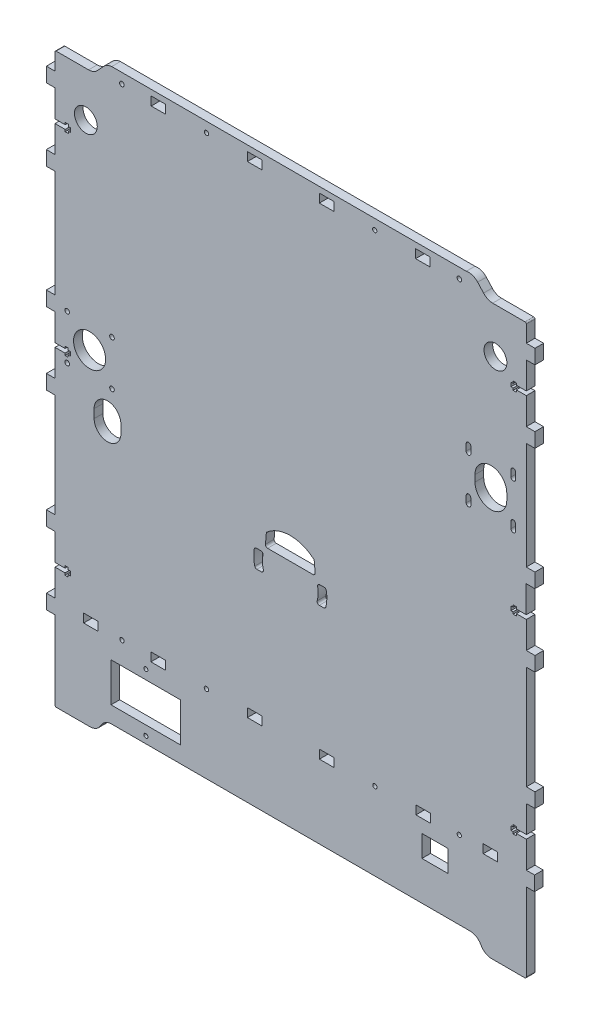
from build123d import *

# Parameters (mm, degrees)
SKETCH_1_R      = 7.9
SKETCH_1_R_2    = 1.6
SKETCH_1_R_3    = 1.5
SKETCH_1_R_4    = 11.1
SKETCH_1_R_5    = 1.4
SKETCH_1_W      = 10
SKETCH_1_H      = 6
SKETCH_1_W_2    = 18
SKETCH_1_H_2    = 15
SKETCH_1_W_3    = 48
SKETCH_1_H_3    = 27
EXTRUDE_1_DEPTH = 6


with BuildPart() as part:
    # Эскиз1 → Бобышка-Вытянуть1 (new body)
    with BuildSketch(Plane.XY):
        with BuildLine():
            Line((-197.487602206, 21.424334113), (-197.486561677, 20.054248176))
            Line((-197.486561677, 20.054248176), (-195.286801854, 20.054248176))
            Line((-195.286801854, 20.054248176), (-195.286817832, 21.426921304))
            Line((-195.286817832, 21.426921304), (-195.286801854, 21.454129382))
            Line((-195.286801854, 21.454129382), (-193.786801854, 21.454129382))
            Line((-193.786801854, 21.454129382), (-193.786801854, 24.24851002))
            Line((-193.786801854, 24.24851002), (-193.786785876, 24.275718097))
            Line((-193.786785876, 24.275718097), (-195.286785876, 24.275718097))
            Line((-195.286785876, 24.275718097), (-195.287641863, 25.64942725))
            Line((-195.287641863, 25.64942725), (-195.287642523, 25.676635332))
            Line((-195.287642523, 25.676635332), (-197.487642934, 25.676635332))
            Line((-197.487642934, 25.676635332), (-197.487638249, 25.64942725))
            Line((-197.487638249, 25.64942725), (-197.487435772, 24.276635347))
            Line((-197.487435772, 24.276635347), (-204.436337757, 24.276635347))
            Line((-204.436337757, 24.276635347), (-204.436337757, 42.876635347))
            Line((-204.436337757, 42.876635347), (-210.436337757, 42.876635347))
            Line((-210.436337757, 42.876635347), (-210.436337757, 52.876635347))
            Line((-210.436337757, 52.876635347), (-204.436337757, 52.876635347))
            Line((-204.436337757, 52.876635347), (-204.436337757, 127.036635347))
            Line((-204.436337757, 127.036635347), (-210.436337757, 127.036635347))
            Line((-210.436337757, 127.036635347), (-210.436337757, 137.036635347))
            Line((-210.436337757, 137.036635347), (-204.436337757, 137.036635347))
            Line((-204.436337757, 137.036635347), (-204.436337757, 155.636635347))
            Line((-204.436337757, 155.636635347), (-197.387139854, 155.636635347))
            Line((-197.387139854, 155.636635347), (-197.387139854, 154.236531323))
            Line((-197.387139854, 154.236531323), (-195.186317271, 154.236531323))
            Line((-195.186317271, 154.236531323), (-195.186317271, 155.618966061))
            Line((-195.186317271, 155.618966061), (-193.715479854, 155.618966061))
            Line((-193.715479854, 155.618966061), (-193.715479854, 158.418966061))
            Line((-193.715479854, 158.418966061), (-195.218141804, 158.418966061))
            Line((-195.218141804, 158.418966061), (-195.218141804, 159.836635347))
            Line((-195.218141804, 159.836635347), (-197.418142215, 159.836635347))
            Line((-197.418142215, 159.836635347), (-197.418142215, 158.436635347))
            Line((-197.418142215, 158.436635347), (-204.436337757, 158.436635347))
            Line((-204.436337757, 158.436635347), (-204.436337757, 177.036635347))
            Line((-204.436337757, 177.036635347), (-210.436337757, 177.036635347))
            Line((-210.436337757, 177.036635347), (-210.436337757, 187.036635347))
            Line((-210.436337757, 187.036635347), (-204.436337757, 187.036635347))
            Line((-204.436337757, 187.036635347), (-204.436337757, 198.258791497))
            ThreePointArc((-204.436337757, 198.258791497), (-204.328344016, 199.026576962), (-203.670309603, 199.436635347))
            Line((-203.670309603, 199.436635347), (-181.21366511, 199.436635347))
            ThreePointArc((-181.21366511, 199.436635347), (-177.786697283, 200.165852645), (-174.944614984, 202.214860835))
            Line((-174.944614984, 202.214860835), (-170.849061928, 206.694475052))
            ThreePointArc((-170.849061928, 206.694475052), (-168.285810468, 208.606816645), (-165.197330366, 209.436635347))
            Line((-165.197330366, 209.436635347), (80.233513167, 209.436635347))
            ThreePointArc((80.233513167, 209.436635347), (84.503563818, 209.155552648), (88.09552196, 206.829573983))
            Line((88.09552196, 206.829573983), (92.195746981, 202.354235654))
            ThreePointArc((92.195746981, 202.354235654), (95.023116575, 200.232431533), (98.467355239, 199.436635347))
            Line((98.467355239, 199.436635347), (120.843662243, 199.436635347))
            ThreePointArc((120.843662243, 199.436635347), (121.494200482, 199.167173586), (121.763662243, 198.516635347))
            Line((121.763662243, 198.516635347), (121.763662243, 187.036635347))
            Line((121.763662243, 187.036635347), (127.763662243, 187.036635347))
            Line((127.763662243, 187.036635347), (127.763662243, 177.036635347))
            Line((127.763662243, 177.036635347), (121.763662243, 177.036635347))
            Line((121.763662243, 177.036635347), (121.763662243, 158.436635347))
            Line((121.763662243, 158.436635347), (114.851661036, 158.436635347))
            Line((114.851661036, 158.436635347), (114.851661036, 159.836739372))
            Line((114.851661036, 159.836739372), (112.650838454, 159.836739372))
            Line((112.650838454, 159.836739372), (112.651660526, 158.436858407))
            Line((112.651660526, 158.436858407), (111.151660785, 158.435977541))
            Line((111.151660785, 158.435977541), (111.15330453, 155.636894735))
            Line((111.15330453, 155.636894735), (112.653304271, 155.637775601))
            Line((112.653304271, 155.637775601), (112.654126952, 154.236858346))
            Line((112.654126952, 154.236858346), (114.854127367, 154.236805006))
            Line((114.854127367, 154.236805006), (114.854161306, 155.636635347))
            Line((114.854161306, 155.636635347), (121.763662346, 155.636635347))
            Line((121.763662346, 155.636635347), (121.763662346, 137.036635347))
            Line((121.763662346, 137.036635347), (127.735522472, 137.036635347))
            Line((127.735522472, 137.036635347), (127.735522472, 127.036635347))
            Line((127.735522472, 127.036635347), (121.735522472, 127.036635347))
            Line((121.735522472, 127.036635347), (121.735522472, 52.876635347))
            Line((121.735522472, 52.876635347), (127.735522472, 52.876635347))
            Line((127.735522472, 52.876635347), (127.735522472, 42.876635347))
            Line((127.735522472, 42.876635347), (121.73141262, 42.876635347))
            Line((121.73141262, 42.876635347), (121.73141262, 24.276635347))
            Line((121.73141262, 24.276635347), (114.867621421, 24.276635347))
            Line((114.867621421, 24.276635347), (114.867616759, 24.303704553))
            Line((114.867616759, 24.303704553), (114.867380328, 25.676569221))
            Line((114.867380328, 25.676569221), (112.666557749, 25.676190201))
            Line((112.666557749, 25.676190201), (112.667616243, 24.303378605))
            Line((112.667616243, 24.303378605), (112.667620905, 24.276309399))
            Line((112.667620905, 24.276309399), (111.167621337, 24.275170207))
            Line((111.167621337, 24.275170207), (111.169742471, 21.503156931))
            Line((111.169742471, 21.503156931), (111.169747133, 21.476087726))
            Line((111.169747133, 21.476087726), (112.6697467, 21.477226918))
            Line((112.6697467, 21.477226918), (112.670805981, 20.103379031))
            Line((112.670805981, 20.103379031), (112.670810643, 20.076309825))
            Line((112.670810643, 20.076309825), (114.87081103, 20.076635363))
            Line((114.87081103, 20.076635363), (114.870806368, 20.103704568))
            Line((114.870806368, 20.103704568), (114.87060387, 21.476635347))
            Line((114.87060387, 21.476635347), (121.780104909, 21.476635347))
            Line((121.780104909, 21.476635347), (121.780104909, 2.876635347))
            Line((121.780104909, 2.876635347), (127.777161917, 2.876635347))
            Line((127.777161917, 2.876635347), (127.777161917, -7.123364653))
            Line((127.777161917, -7.123364653), (121.777161917, -7.123364653))
            Line((121.777161917, -7.123364653), (121.777161917, -78.853364653))
            Line((121.777161917, -78.853364653), (127.777161917, -78.853364653))
            Line((127.777161917, -78.853364653), (127.777161917, -88.853364653))
            Line((127.777161917, -88.853364653), (121.865168685, -88.853364653))
            Line((121.865168685, -88.853364653), (121.865168685, -107.433364653))
            Line((121.865168685, -107.433364653), (114.865167478, -107.433364653))
            Line((114.865167478, -107.433364653), (114.865167478, -106.033260628))
            Line((114.865167478, -106.033260628), (112.664344896, -106.033260628))
            Line((112.664344896, -106.033260628), (112.665166968, -107.433141593))
            Line((112.665166968, -107.433141593), (111.165167227, -107.434022459))
            Line((111.165167227, -107.434022459), (111.166810972, -110.233105265))
            Line((111.166810972, -110.233105265), (112.666810713, -110.232224399))
            Line((112.666810713, -110.232224399), (112.667633394, -111.633141654))
            Line((112.667633394, -111.633141654), (114.870838426, -111.633195072))
            Line((114.870838426, -111.633195072), (114.870872365, -110.233364653))
            Line((114.870872365, -110.233364653), (121.763662243, -110.233364653))
            Line((121.763662243, -110.233364653), (121.763662243, -128.843364653))
            Line((121.763662243, -128.843364653), (127.47801658, -128.843364653))
            Line((127.47801658, -128.843364653), (127.47801658, -138.843364653))
            Line((127.47801658, -138.843364653), (121.763662243, -138.843364653))
            Line((121.763662243, -138.843364653), (121.763662243, -192.691567269))
            ThreePointArc((121.763662243, -192.691567269), (121.517292149, -193.467005783), (120.806727052, -193.863364653))
            Line((120.806727052, -193.863364653), (97.806335191, -193.863364653))
            ThreePointArc((97.806335191, -193.863364653), (94.253903134, -193.044338241), (91.377078173, -190.805040153))
            Line((91.377078173, -190.805040153), (89.320374027, -187.785387058))
            ThreePointArc((89.320374027, -187.785387058), (86.401251485, -185.545465551), (82.80899626, -184.74908174))
            Line((82.80899626, -184.74908174), (-165.15931457, -184.74908174))
            ThreePointArc((-165.15931457, -184.74908174), (-168.751153818, -185.547339588), (-171.669107354, -187.788783751))
            Line((-171.669107354, -187.788783751), (-173.724235811, -190.809509456))
            ThreePointArc((-173.724235811, -190.809509456), (-176.639720291, -193.057976183), (-180.232351887, -193.863364653))
            Line((-180.232351887, -193.863364653), (-203.35849545, -193.863364653))
            ThreePointArc((-203.35849545, -193.863364653), (-204.158043867, -193.595905372), (-204.436337757, -192.800063271))
            Line((-204.436337757, -192.800063271), (-204.436337757, -138.843364653))
            Line((-204.436337757, -138.843364653), (-210.431075973, -138.843364653))
            Line((-210.431075973, -138.843364653), (-210.431075973, -128.843364653))
            Line((-210.431075973, -128.843364653), (-204.436337757, -128.843364653))
            Line((-204.436337757, -128.843364653), (-204.436337757, -110.233364653))
            Line((-204.436337757, -110.233364653), (-197.523921698, -110.233364653))
            Line((-197.523921698, -110.233364653), (-197.523672393, -111.68096837))
            Line((-197.523672393, -111.68096837), (-195.335013115, -111.679449577))
            Line((-195.335013115, -111.679449577), (-195.336806264, -110.279844178))
            Line((-195.336806264, -110.279844178), (-193.677914745, -110.277769726))
            Line((-193.677914745, -110.277769726), (-193.68325579, -107.284374899))
            Line((-193.68325579, -107.284374899), (-195.328101329, -107.286501137))
            Line((-195.328101329, -107.286501137), (-195.329942101, -105.895501094))
            Line((-195.329942101, -105.895501094), (-197.490847394, -105.897039343))
            Line((-197.490847394, -105.897039343), (-197.490620059, -107.433364653))
            Line((-197.490620059, -107.433364653), (-204.436337757, -107.433364653))
            Line((-204.436337757, -107.433364653), (-204.436337757, -88.853364653))
            Line((-204.436337757, -88.853364653), (-210.436337757, -88.853364653))
            Line((-210.436337757, -88.853364653), (-210.436337757, -78.853364653))
            Line((-210.436337757, -78.853364653), (-204.436337757, -78.853364653))
            Line((-204.436337757, -78.853364653), (-204.436337757, -7.123364653))
            Line((-204.436337757, -7.123364653), (-210.436337757, -7.123364653))
            Line((-210.436337757, -7.123364653), (-210.436337757, 2.876635347))
            Line((-210.436337757, 2.876635347), (-204.436337757, 2.876635347))
            Line((-204.436337757, 2.876635347), (-204.436337757, 21.456635347))
            Line((-204.436337757, 21.456635347), (-204.436337757, 21.476635347))
            Line((-204.436337757, 21.476635347), (-197.487641927, 21.476635347))
            Line((-197.487641927, 21.476635347), (-197.487602206, 21.424334113))
        make_face()
        with Locations((-183.086337757, 168.436635347)):
            Circle(SKETCH_1_R, mode=Mode.SUBTRACT)
        with Locations((100.408400459, 168.436635347)):
            Circle(SKETCH_1_R, mode=Mode.SUBTRACT)
        with Locations((-158.141599541, 202.436635347)):
            Circle(SKETCH_1_R_2, mode=Mode.SUBTRACT)
        with Locations((75.458400459, 202.436635347)):
            Circle(SKETCH_1_R_2, mode=Mode.SUBTRACT)
        with Locations((16.858400459, 202.436635347)):
            Circle(SKETCH_1_R_3, mode=Mode.SUBTRACT)
        with Locations((-99.541599541, 202.436635347)):
            Circle(SKETCH_1_R_3, mode=Mode.SUBTRACT)
        with Locations((-196.006387984, 47.305988871)):
            Circle(SKETCH_1_R_2, mode=Mode.SUBTRACT)
        with Locations((-165.006387984, 16.305988871)):
            Circle(SKETCH_1_R_2, mode=Mode.SUBTRACT)
        with Locations((-196.006387984, 16.305988871)):
            Circle(SKETCH_1_R_2, mode=Mode.SUBTRACT)
        with Locations((-180.506387984, 31.805988871)):
            Circle(SKETCH_1_R_4, mode=Mode.SUBTRACT)
        with Locations((-165.006387984, 47.305988871)):
            Circle(SKETCH_1_R_2, mode=Mode.SUBTRACT)
        with Locations((75.383662243, -130.863364653)):
            Circle(SKETCH_1_R_3, mode=Mode.SUBTRACT)
        with Locations((16.983662243, -130.863364653)):
            Circle(SKETCH_1_R_3, mode=Mode.SUBTRACT)
        with Locations((-99.656337757, -130.863364653)):
            Circle(SKETCH_1_R_3, mode=Mode.SUBTRACT)
        with Locations((-158.056337757, -130.863364653)):
            Circle(SKETCH_1_R_3, mode=Mode.SUBTRACT)
        with Locations((-141.555168688, -179.94908174)):
            Circle(SKETCH_1_R_5, mode=Mode.SUBTRACT)
        with Locations((-141.555168688, -139.94908174)):
            Circle(SKETCH_1_R_5, mode=Mode.SUBTRACT)
        with Locations((-16.416337757, -130.863364653)):
            Rectangle(SKETCH_1_W, SKETCH_1_H, mode=Mode.SUBTRACT)
        with Locations((-66.256337757, -130.863364653)):
            Rectangle(SKETCH_1_W, SKETCH_1_H, mode=Mode.SUBTRACT)
        with Locations((58.493612016, -150.412798349)):
            Rectangle(SKETCH_1_W_2, SKETCH_1_H_2, mode=Mode.SUBTRACT)
        with Locations((-133.056337757, -130.863364653)):
            Rectangle(SKETCH_1_W, SKETCH_1_H, mode=Mode.SUBTRACT)
        with Locations((-179.636337757, -130.863364653)):
            Rectangle(SKETCH_1_W, SKETCH_1_H, mode=Mode.SUBTRACT)
        with Locations((96.963662243, -130.863364653)):
            Rectangle(SKETCH_1_W, SKETCH_1_H, mode=Mode.SUBTRACT)
        with Locations((50.383662243, -130.863364653)):
            Rectangle(SKETCH_1_W, SKETCH_1_H, mode=Mode.SUBTRACT)
        with BuildLine():
            Line((-18.134599873, -29.194011129), (-21.184312759, -29.194011129))
            ThreePointArc((-21.184312759, -29.194011129), (-22.342493839, -29.740797309), (-22.65630504, -30.982522347))
            ThreePointArc((-22.65630504, -30.982522347), (-22.309250666, -35.408837109), (-22.983068573, -39.797308203))
            ThreePointArc((-22.983068573, -39.797308203), (-22.72917458, -41.103666451), (-21.536477135, -41.694011129))
            Line((-21.536477135, -41.694011129), (-18.440328783, -41.694011129))
            ThreePointArc((-18.440328783, -41.694011129), (-17.510284763, -41.370879057), (-16.980943477, -40.540701957))
            ThreePointArc((-16.980943477, -40.540701957), (-16.309095275, -35.507678983), (-16.655943039, -30.441872344))
            ThreePointArc((-16.655943039, -30.441872344), (-17.167182739, -29.547667337), (-18.134599873, -29.194011129))
        make_face(mode=Mode.SUBTRACT)
        with BuildLine():
            Line((-64.7445198, -41.694011128), (-61.648371447, -41.694011128))
            ThreePointArc((-61.648371447, -41.694011128), (-60.455674003, -41.103666451), (-60.201780009, -39.797308203))
            ThreePointArc((-60.201780009, -39.797308203), (-60.875597917, -35.408837109), (-60.528543542, -30.982522347))
            ThreePointArc((-60.528543542, -30.982522347), (-60.842354744, -29.740797309), (-62.000535824, -29.194011129))
            Line((-62.000535824, -29.194011129), (-65.05024871, -29.194011129))
            ThreePointArc((-65.05024871, -29.194011129), (-66.017665844, -29.547667337), (-66.528905544, -30.441872344))
            ThreePointArc((-66.528905544, -30.441872344), (-66.875753307, -35.507678983), (-66.203905105, -40.540701957))
            ThreePointArc((-66.203905105, -40.540701957), (-65.67456382, -41.370879057), (-64.7445198, -41.694011128))
        make_face(mode=Mode.SUBTRACT)
        with BuildLine():
            Line((-58.18830834, -16.824477467), (-58.795688036, -23.766859164))
            ThreePointArc((-58.795688036, -23.766859164), (-58.407311994, -24.91097809), (-57.301395989, -25.397592779))
            Line((-57.301395989, -25.397592779), (-25.883452594, -25.397592779))
            ThreePointArc((-25.883452594, -25.397592779), (-24.777536589, -24.91097809), (-24.389160547, -23.766859164))
            Line((-24.389160547, -23.766859164), (-24.996540243, -16.824477467))
            ThreePointArc((-24.996540243, -16.824477467), (-25.15785371, -16.267338924), (-25.518477328, -15.813052674))
            ThreePointArc((-25.518477328, -15.813052674), (-41.592424291, -9.897592775), (-57.666371255, -15.813052674))
            ThreePointArc((-57.666371255, -15.813052674), (-58.026994873, -16.267338924), (-58.18830834, -16.824477467))
        make_face(mode=Mode.SUBTRACT)
        with Locations((-141.692424291, -159.912798349)):
            Rectangle(SKETCH_1_W_3, SKETCH_1_H_3, mode=Mode.SUBTRACT)
        with Locations((-132.841599541, 202.436635347)):
            Rectangle(SKETCH_1_W, SKETCH_1_H, mode=Mode.SUBTRACT)
        with Locations((50.158400459, 202.436635347)):
            Rectangle(SKETCH_1_W, SKETCH_1_H, mode=Mode.SUBTRACT)
        with Locations((-66.241599541, 202.436635347)):
            Rectangle(SKETCH_1_W, SKETCH_1_H, mode=Mode.SUBTRACT)
        with Locations((-16.441599541, 202.436635347)):
            Rectangle(SKETCH_1_W, SKETCH_1_H, mode=Mode.SUBTRACT)
        with BuildLine():
            Line((-158.856387984, -7.694011129), (-158.856387984, -1.694011129))
            ThreePointArc((-158.856387984, -1.694011129), (-168.106387984, 7.555988871), (-177.356387984, -1.694011129))
            Line((-177.356387984, -1.694011129), (-177.356387984, -7.694011129))
            ThreePointArc((-177.356387984, -7.694011129), (-168.106387984, -16.944011129), (-158.856387984, -7.694011129))
        make_face(mode=Mode.SUBTRACT)
        with BuildLine():
            Line((86.257214298, 90.555988871), (86.257214298, 86.055988871))
            ThreePointArc((86.257214298, 86.055988871), (97.257214298, 75.055988871), (108.257214298, 86.055988871))
            Line((108.257214298, 86.055988871), (108.257214298, 90.555988871))
            ThreePointArc((108.257214298, 90.555988871), (97.257214298, 101.555988871), (86.257214298, 90.555988871))
        make_face(mode=Mode.SUBTRACT)
        with BuildLine():
            Line((111.157214298, 75.055988871), (111.157214298, 70.555988871))
            ThreePointArc((111.157214298, 70.555988871), (112.757214298, 68.955988871), (114.357214298, 70.555988871))
            Line((114.357214298, 70.555988871), (114.357214298, 75.055988871))
            ThreePointArc((114.357214298, 75.055988871), (112.757214298, 76.655988871), (111.157214298, 75.055988871))
        make_face(mode=Mode.SUBTRACT)
        with BuildLine():
            Line((114.357214298, 101.555988871), (114.357214298, 106.055988871))
            ThreePointArc((114.357214298, 106.055988871), (112.757214298, 107.655988871), (111.157214298, 106.055988871))
            Line((111.157214298, 106.055988871), (111.157214298, 101.555988871))
            ThreePointArc((111.157214298, 101.555988871), (112.757214298, 99.955988871), (114.357214298, 101.555988871))
        make_face(mode=Mode.SUBTRACT)
        with BuildLine():
            Line((80.157214298, 75.055988871), (80.157214298, 70.555988871))
            ThreePointArc((80.157214298, 70.555988871), (81.757214298, 68.955988871), (83.357214298, 70.555988871))
            Line((83.357214298, 70.555988871), (83.357214298, 75.055988871))
            ThreePointArc((83.357214298, 75.055988871), (81.757214298, 76.655988871), (80.157214298, 75.055988871))
        make_face(mode=Mode.SUBTRACT)
        with BuildLine():
            Line((83.357214298, 101.555988871), (83.357214298, 106.055988871))
            ThreePointArc((83.357214298, 106.055988871), (81.757214298, 107.655988871), (80.157214298, 106.055988871))
            Line((80.157214298, 106.055988871), (80.157214298, 101.555988871))
            ThreePointArc((80.157214298, 101.555988871), (81.757214298, 99.955988871), (83.357214298, 101.555988871))
        make_face(mode=Mode.SUBTRACT)
    extrude(amount=EXTRUDE_1_DEPTH)


solid = part.part
